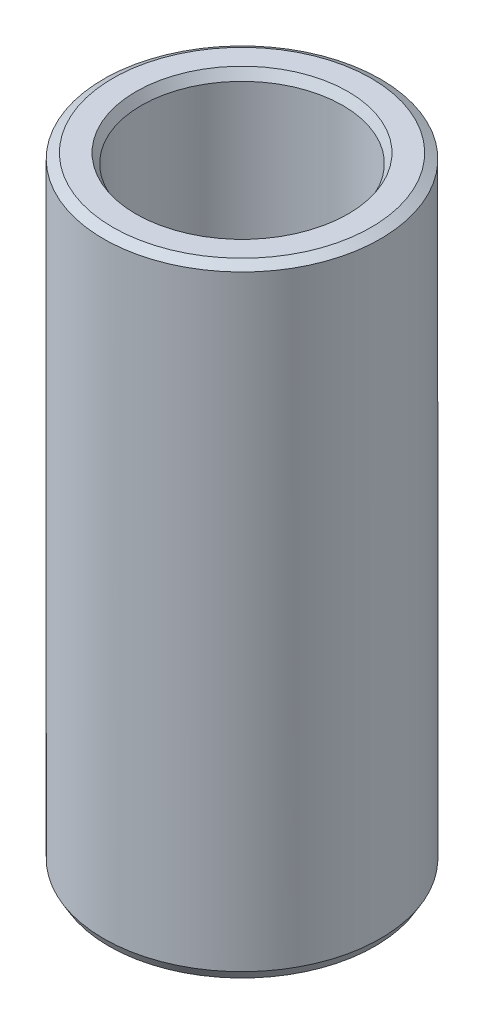
from build123d import *
from OCP.BRepFilletAPI import BRepFilletAPI_MakeChamfer

# Parameters (mm, degrees)
SKETCH1_R           = 25
BOSS_EXTRUDE1_DEPTH = 112.047563007
SKETCH2_R           = 18.180257071
CUT_EXTRUDE1_DEPTH  = 118.493218424
CHAMFER1_SIZE       = 0.9702548
CHAMFER1_SIZE2      = 1.68053061


with BuildPart() as part:
    # Sketch1 → Boss-Extrude1 (new body)
    with BuildSketch(Plane(origin=(0, 0, 0), x_dir=(1, 0, 0), z_dir=(0, 1, 0))):
        Circle(SKETCH1_R)
    extrude(amount=BOSS_EXTRUDE1_DEPTH)

    # Sketch2 → Cut-Extrude1 (cut, through all)
    with BuildSketch(Plane(origin=(0, 0, 0), x_dir=(1, 0, 0), z_dir=(0, 1, 0))):
        Circle(SKETCH2_R)
    extrude(amount=CUT_EXTRUDE1_DEPTH, mode=Mode.SUBTRACT)

    # Chamfer1: one chamfer whose edges measure the first distance from different faces: ONE call of the kernel's chamfer builder (chamfer() names one face for all edges)
    chamfer1_edges_1 = [part.edges().sort_by_distance(p)[0] for p in [
        (-18.180257071, 112.047563007, 0),
    ]]
    chamfer1_side_1 = [part.faces().sort_by_distance(p)[0] for p in [
        (-24.292893219, 112.047563007, 0),
    ]]
    chamfer1_edges_2 = [part.edges().sort_by_distance(p)[0] for p in [
        (-18.180257071, 0, 0),
    ]]
    chamfer1_side_2 = [part.faces().sort_by_distance(p)[0] for p in [
        (-18.180257071, 56.023781503, 0),
    ]]
    chamfer1_edges_3 = [part.edges().sort_by_distance(p)[0] for p in [
        (-25, 0, 0),
    ]]
    chamfer1_side_3 = [part.faces().sort_by_distance(p)[0] for p in [
        (-24.292893219, 0, 0),
    ]]
    chamfer1_edges_4 = [part.edges().sort_by_distance(p)[0] for p in [
        (-25, 112.047563007, 0),
    ]]
    chamfer1_side_4 = [part.faces().sort_by_distance(p)[0] for p in [
        (-25, 56.023781503, 0),
    ]]
    chamfer1 = BRepFilletAPI_MakeChamfer(part.part.solid().wrapped)
    for e in chamfer1_edges_1:
        chamfer1.Add(CHAMFER1_SIZE, CHAMFER1_SIZE2, e.wrapped, chamfer1_side_1[0].wrapped)  # the first distance lies on this face
    for e in chamfer1_edges_2:
        chamfer1.Add(CHAMFER1_SIZE, CHAMFER1_SIZE2, e.wrapped, chamfer1_side_2[0].wrapped)  # the first distance lies on this face
    for e in chamfer1_edges_3:
        chamfer1.Add(CHAMFER1_SIZE, CHAMFER1_SIZE2, e.wrapped, chamfer1_side_3[0].wrapped)  # the first distance lies on this face
    for e in chamfer1_edges_4:
        chamfer1.Add(CHAMFER1_SIZE, CHAMFER1_SIZE2, e.wrapped, chamfer1_side_4[0].wrapped)  # the first distance lies on this face
    add(Compound.cast(chamfer1.Shape()), mode=Mode.REPLACE)


solid = part.part
